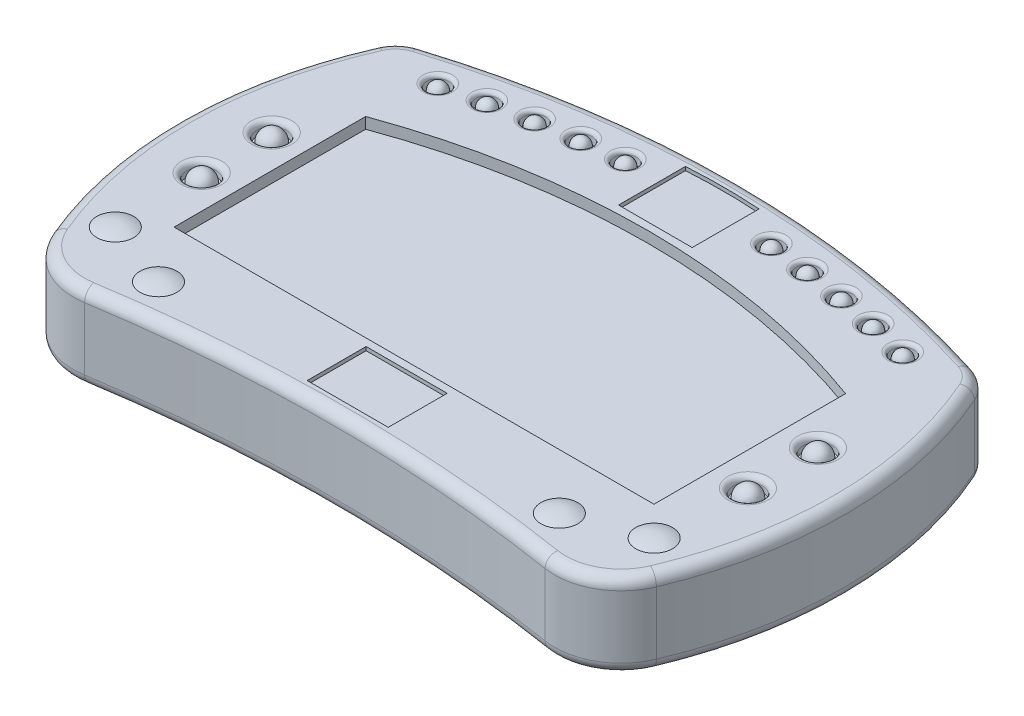
from build123d import *

# Parameters (mm, degrees)
BOSS_EXTRUDE1_DEPTH      = 23
FILLET1_R                = 3
CUT_EXTRUDE1_DEPTH       = 3
CUT_EXTRUDE2_DEPTH       = 1
SKETCH4_R                = 3
CUT_EXTRUDE3_DEPTH       = 3
FILLET2_R                = 1
SKETCH5_R                = 2.25
BOSS_EXTRUDE2_DEPTH      = 3.5
FILLET5_R                = 2.25
CIRPATTERN1_COUNT        = 5
CIRPATTERN1_ANGLE        = 10.5
FILLET5_OF_CIRPATTERN1_R = 2.25
SKETCH7_R                = 4
CUT_EXTRUDE4_DEPTH       = 3
FILLET6_R                = 1.5
SKETCH8_R                = 3.25
BOSS_EXTRUDE4_DEPTH      = 4
FILLET7_R                = 3.25
LPATTERN1_COUNT          = 2
LPATTERN1_PITCH          = 20
SKETCH13_W               = 22
SKETCH13_H               = 16
CUT_EXTRUDE5_DEPTH       = 1
SKETCH14_R               = 15
BOSS_EXTRUDE5_DEPTH      = 10
SKETCH15_R               = 5
BOSS_EXTRUDE6_DEPTH      = 10


# Read off the part's stored shape, not the designer's step: Mirror1
with BuildPart() as part:
    # Sketch1 → Boss-Extrude1 (new body)
    with BuildSketch(Plane(origin=(0, 0, 0), x_dir=(1, 0, 0), z_dir=(0, 1, 0))):
        with BuildLine():
            ThreePointArc((-75, 83.484800354), (0, 95), (75, 83.484800354))
            ThreePointArc((75, 83.484800354), (78.66774915, 81.397999921), (81.148164216, 77.984107572))
            ThreePointArc((81.148164216, 77.984107572), (90.514231183, 34.511226724), (81.902658248, -9.117380762))
            ThreePointArc((81.902658248, -9.117380762), (74.064198719, -17.863269733), (62.5, -19.912984268))
            ThreePointArc((62.5, -19.912984268), (0, -15), (-62.5, -19.912984268))
            ThreePointArc((-62.5, -19.912984268), (-74.064198719, -17.863269733), (-81.902658248, -9.117380762))
            ThreePointArc((-81.902658248, -9.117380762), (-90.514231183, 34.511226724), (-81.148164216, 77.984107572))
            ThreePointArc((-81.148164216, 77.984107572), (-78.66774915, 81.397999921), (-75, 83.484800354))
        make_face()
    extrude(amount=BOSS_EXTRUDE1_DEPTH)

    # Fillet1
    fillet1_edges = [part.edges().sort_by_distance(p)[0] for p in [
        (-74.064198719, 23, 17.863269733),
        (-90.514231183, 0, -34.511226724),
        (-78.66774915, 0, -81.397999921),
        (0, 23, 15),
        (74.064198719, 23, 17.863269733),
        (90.514231183, 23, -34.511226724),
        (78.66774915, 23, -81.397999921),
        (0, 23, -95),
        (-78.66774915, 23, -81.397999921),
        (-90.514231183, 23, -34.511226724),
        (0, 0, -95),
        (78.66774915, 0, -81.397999921),
        (90.514231183, 0, -34.511226724),
        (74.064198719, 0, 17.863269733),
        (0, 0, 15),
        (-74.064198719, 0, 17.863269733),
    ]]
    fillet(fillet1_edges, radius=FILLET1_R)

    # Sketch2 → Cut-Extrude1 (cut)
    with BuildSketch(Plane(origin=(0, 23, 0), x_dir=(1, 0, 0), z_dir=(0, 1, 0))):
        with BuildLine():
            Line((-65.137631873, 59), (-65.137631873, 7))
            Line((-65.137631873, 7), (65.137631873, 7))
            Line((65.137631873, 7), (65.137631873, 59))
            ThreePointArc((65.137631873, 59), (0, 70.514457409), (-65.137631873, 59))
        make_face()
    extrude(amount=-CUT_EXTRUDE1_DEPTH, mode=Mode.SUBTRACT)

    # Sketch3 → Cut-Extrude2 (cut)
    with BuildSketch(Plane(origin=(0, 23, 0), x_dir=(1, 0, 0), z_dir=(0, 1, 0))):
        with BuildLine():
            Line((-10, 90.666295471), (-10, 72.514457409))
            Line((-10, 72.514457409), (10, 72.514457409))
            Line((10, 72.514457409), (10, 90.666295471))
            ThreePointArc((10, 90.666295471), (0, 91), (-10, 90.666295471))
        make_face()
    extrude(amount=-CUT_EXTRUDE2_DEPTH, mode=Mode.SUBTRACT)

    # Sketch4 → Cut-Extrude3 (cut)
    with BuildSketch(Plane(origin=(0, 23, 0), x_dir=(1, 0, 0), z_dir=(0, 1, 0))):
        with Locations(Location((-63.1, 76.556451001, 0), (0, 0, 270))):
            Circle(SKETCH4_R)
        with Locations(Location((-52.423506287, 79.204560136, 0), (0, 0, 270))):
            Circle(SKETCH4_R)
        with Locations(Location((-41.636886805, 81.360677053, 0), (0, 0, 270))):
            Circle(SKETCH4_R)
        with Locations(Location((-30.762800947, 83.020272409, 0), (0, 0, 270))):
            Circle(SKETCH4_R)
        with Locations(Location((-19.824091844, 84.179859902, 0), (0, 0, 270))):
            Circle(SKETCH4_R)
        with Locations(Location((63.1, 76.556451001, 0), (0, 0, 90))):
            Circle(SKETCH4_R)
        with Locations(Location((41.636886805, 81.360677053, 0), (0, 0, 90))):
            Circle(SKETCH4_R)
        with Locations(Location((52.423506287, 79.204560136, 0), (0, 0, 90))):
            Circle(SKETCH4_R)
        with Locations(Location((19.824091844, 84.179859902, 0), (0, 0, 90))):
            Circle(SKETCH4_R)
        with Locations(Location((30.762800947, 83.020272409, 0), (0, 0, 90))):
            Circle(SKETCH4_R)
    extrude(amount=-CUT_EXTRUDE3_DEPTH, mode=Mode.SUBTRACT)

    # Fillet2
    fillet2_edges = [part.edges().sort_by_distance(p)[0] for p in [
        (-63.1, 23, -79.556451001),
        (-52.423506287, 23, -82.204560136),
        (-41.636886805, 23, -84.360677053),
        (-30.762800947, 23, -86.020272409),
        (-19.824091844, 23, -87.179859902),
        (63.1, 23, -73.556451001),
        (41.636886805, 23, -78.360677053),
        (52.423506287, 23, -76.204560136),
        (19.824091844, 23, -81.179859902),
        (30.762800947, 23, -80.020272409),
    ]]
    fillet(fillet2_edges, radius=FILLET2_R)

    # Sketch5 → Boss-Extrude2 (add)
    with BuildSketch(Plane(origin=(0, 20, 0), x_dir=(1, 0, 0), z_dir=(0, 1, 0))):
        with Locations(Location((-19.824091844, 84.179859902, 0), (0, 0, 270))):
            Circle(SKETCH5_R)
    boss_extrude2 = extrude(amount=BOSS_EXTRUDE2_DEPTH)

    # Fillet5
    fillet5_edges = [part.edges().sort_by_distance(p)[0] for p in [
        (-19.824091844, 23.5, -86.429859902),
    ]]
    fillet(fillet5_edges, radius=FILLET5_R)

    # CirPattern1: Boss-Extrude2 ×5 about axis
    cirpattern1_axis = Axis((0, 0, 155), (0, 1, 0))
    for i in range(1, CIRPATTERN1_COUNT):
        add(boss_extrude2.rotate(cirpattern1_axis, i * CIRPATTERN1_ANGLE / (CIRPATTERN1_COUNT - 1)))

    # Fillet5 of CirPattern1
    fillet5_of_cirpattern1_edges = [part.edges().sort_by_distance(p)[0] for p in [
        (-30.860504083, 23.5, -85.268602105),
        (-41.832151317, 23.5, -83.603107661),
        (-52.71600804, 23.5, -81.436871841),
        (-63.489232982, 23.5, -78.774440786),
    ]]
    fillet(fillet5_of_cirpattern1_edges, radius=FILLET5_OF_CIRPATTERN1_R)

    # Mirror1 outline → Mirror1 (revolve)
    with BuildSketch(Plane(origin=(19.824091844, 0, -84.179859902), x_dir=(1, 0, 0), z_dir=(0, 0, 1))):
        with BuildLine():
            Line((2.25, 20), (2.25, 21.249999998))
            ThreePointArc((2.25, 21.249999998), (1.590990258, 22.840990257), (0, 23.5))
            Line((0, 23.5), (0, 20))
            Line((0, 20), (2.25, 20))
        make_face()
    revolve(axis=Axis((19.824091844, 0, -84.179859902), (0, 1, 0)))

    # Mirror1 2 outline → Mirror1 2 (revolve)
    with BuildSketch(Plane(origin=(30.757456632, 0, -83.020963072), x_dir=(1, 0, 0), z_dir=(0, 0, 1))):
        with BuildLine():
            Line((2.25, 20), (2.25, 21.249999998))
            ThreePointArc((2.25, 21.249999998), (1.590990258, 22.840990257), (0, 23.5))
            Line((0, 23.5), (0, 20))
            Line((0, 20), (2.25, 20))
        make_face()
    revolve(axis=Axis((30.757456632, 0, -83.020963072), (0, 1, 0)))

    # Mirror1 3 outline → Mirror1 3 (revolve)
    with BuildSketch(Plane(origin=(41.626272675, 0, -81.362546574), x_dir=(1, 0, 0), z_dir=(0, 0, 1))):
        with BuildLine():
            Line((2.25, 20), (2.25, 21.249999998))
            ThreePointArc((2.25, 21.249999998), (1.590990258, 22.840990257), (0, 23.5))
            Line((0, 23.5), (0, 20))
            Line((0, 20), (2.25, 20))
        make_face()
    revolve(axis=Axis((41.626272675, 0, -81.362546574), (0, 1, 0)))

    # Mirror1 4 outline → Mirror1 4 (revolve)
    with BuildSketch(Plane(origin=(52.407730271, 0, -79.208090825), x_dir=(1, 0, 0), z_dir=(0, 0, 1))):
        with BuildLine():
            Line((2.25, 20), (2.25, 21.249999998))
            ThreePointArc((2.25, 21.249999998), (1.590990258, 22.840990257), (0, 23.5))
            Line((0, 23.5), (0, 20))
            Line((0, 20), (2.25, 20))
        make_face()
    revolve(axis=Axis((52.407730271, 0, -79.208090825), (0, 1, 0)))

    # Mirror1 5 outline → Mirror1 5 (revolve)
    with BuildSketch(Plane(origin=(63.07920305, 0, -76.562117244), x_dir=(1, 0, 0), z_dir=(0, 0, 1))):
        with BuildLine():
            Line((2.25, 20), (2.25, 21.249999998))
            ThreePointArc((2.25, 21.249999998), (1.590990258, 22.840990257), (0, 23.5))
            Line((0, 23.5), (0, 20))
            Line((0, 20), (2.25, 20))
        make_face()
    revolve(axis=Axis((63.07920305, 0, -76.562117244), (0, 1, 0)))

    # Sketch7 → Cut-Extrude4 (cut)
    with BuildSketch(Plane(origin=(0, 23, 0), x_dir=(1, 0, 0), z_dir=(0, 1, 0))):
        with Locations(Location((-74.137631873, 42.5, 0), (0, 0, 270))):
            Circle(SKETCH7_R)
        with Locations(Location((-74.137631873, 23.5, 0), (0, 0, 270))):
            Circle(SKETCH7_R)
        with Locations(Location((74.137631873, 23.5, 0), (0, 0, 90))):
            Circle(SKETCH7_R)
        with Locations(Location((74.137631873, 42.5, 0), (0, 0, 90))):
            Circle(SKETCH7_R)
    extrude(amount=-CUT_EXTRUDE4_DEPTH, mode=Mode.SUBTRACT)

    # Fillet6
    fillet6_edges = [part.edges().sort_by_distance(p)[0] for p in [
        (-74.137631873, 23, -46.5),
        (-74.137631873, 23, -27.5),
        (74.137631873, 23, -19.5),
        (74.137631873, 23, -38.5),
    ]]
    fillet(fillet6_edges, radius=FILLET6_R)

    # Sketch8 → Boss-Extrude4 (add)
    with BuildSketch(Plane(origin=(0, 20, 0), x_dir=(1, 0, 0), z_dir=(0, 1, 0))):
        with Locations(Location((-74.137631873, 42.5, 0), (0, 0, 270))):
            Circle(SKETCH8_R)
        with Locations(Location((-74.137631873, 23.5, 0), (0, 0, 270))):
            Circle(SKETCH8_R)
        with Locations(Location((74.137631873, 23.5, 0), (0, 0, 90))):
            Circle(SKETCH8_R)
        with Locations(Location((74.137631873, 42.5, 0), (0, 0, 90))):
            Circle(SKETCH8_R)
    extrude(amount=BOSS_EXTRUDE4_DEPTH)

    # Fillet7
    fillet7_edges = [part.edges().sort_by_distance(p)[0] for p in [
        (-74.137631873, 24, -45.75),
        (-74.137631873, 24, -26.75),
        (74.137631873, 24, -20.25),
        (74.137631873, 24, -39.25),
    ]]
    fillet(fillet7_edges, radius=FILLET7_R)

    # Sketch11 → Revolve1 (revolve)
    with BuildSketch(Plane.XY.offset(0.953495395)):
        with BuildLine():
            Line((-78.137631873, 23), (-73.137631873, 23))
            Line((-73.137631873, 23), (-73.137631873, 24))
            ThreePointArc((-73.137631873, 24), (-75.696375073, 23.793715997), (-78.137631873, 23))
        make_face()
    revolve1 = revolve(axis=Axis((-73.137631873, 23, 0.953495395), (0, 1, 0)))

    # LPattern1: Revolve1 ×2
    with Locations(*[Vector(0.9367496997597597, 0, 0.3500000000000001) * (i * LPATTERN1_PITCH) for i in range(1, LPATTERN1_COUNT)]):
        add(revolve1)

    # Mirror2: Revolve1 across plane
    add(revolve1.mirror(Plane(origin=(0, 0, 0), x_dir=(0, 0, 1), z_dir=(1, 0, 0))))

    # Mirror2 copy 1 sketch → Mirror2 copy 1 (revolve)
    with BuildSketch(Plane(origin=(-18.734993995, 0, 7.953495395), x_dir=(-1, 0, 0), z_dir=(0, 0, 1))):
        with BuildLine():
            Line((-78.137631873, -23), (-73.137631873, -23))
            Line((-73.137631873, -23), (-73.137631873, -24))
            ThreePointArc((-73.137631873, -24), (-75.696375073, -23.793715997), (-78.137631873, -23))
        make_face()
    revolve(axis=Axis((54.402637878, 23, 7.953495395), (0, -1, 0)))

    # Sketch13 → Cut-Extrude5 (cut)
    with BuildSketch(Plane(origin=(0, 23, 0), x_dir=(1, 0, 0), z_dir=(0, 1, 0))):
        with Locations((0, -3)):
            Rectangle(SKETCH13_W, SKETCH13_H)
    extrude(amount=-CUT_EXTRUDE5_DEPTH, mode=Mode.SUBTRACT)

    # Sketch14 → Boss-Extrude5 (add)
    with BuildSketch(Plane.XZ):
        with Locations(Location((0, -40, 0), (0, 0, 90))):
            Circle(SKETCH14_R)
    extrude(amount=BOSS_EXTRUDE5_DEPTH)

    # Sketch15 → Boss-Extrude6 (add)
    with BuildSketch(Plane.XZ.offset(10)):
        with Locations(Location((0, -40, 0), (0, 0, 270))):
            Circle(SKETCH15_R)
    extrude(amount=BOSS_EXTRUDE6_DEPTH)


solid = part.part
